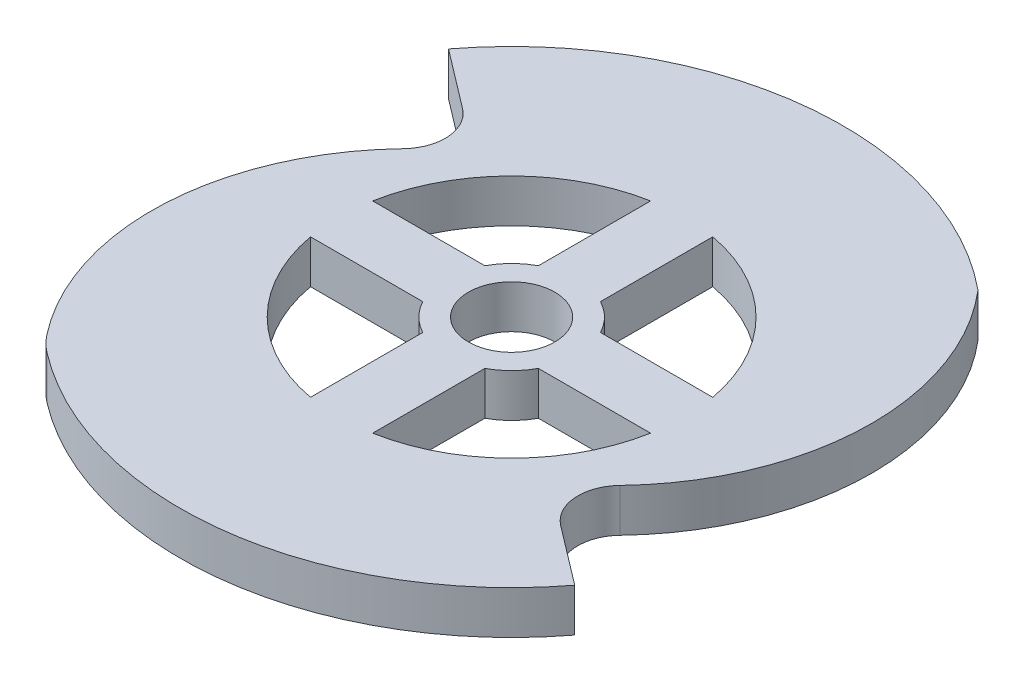
from build123d import *

# Parameters (mm, degrees)
SKETCH1_R           = 10
BOSS_EXTRUDE4_DEPTH = 10


with BuildPart() as part:
    # Sketch1 → Boss-Extrude4 (new body)
    with BuildSketch(Plane(origin=(0, 0, 0), x_dir=(1, 0, 0), z_dir=(0, 1, 0))):
        with BuildLine():
            ThreePointArc((48.558112711, 59.369560199), (-8.988128364, 76.16986633), (-61.043340866, 46.43646761))
            Line((-61.043340866, 46.43646761), (-47.4390603, 36.087513492))
            ThreePointArc((-47.4390603, 36.087513492), (-43.523761966, 28.906139952), (-46.278379725, 21.204596733))
            ThreePointArc((-46.278379725, 21.204596733), (-62.912922905, -17.344588104), (-50.204962373, -57.360277746))
            ThreePointArc((-50.204962373, -57.360277746), (-48.526113995, -59.243612618), (-46.623515218, -60.900597837))
            ThreePointArc((-46.623515218, -60.900597837), (10.212032546, -76.015454872), (61.043340866, -46.43646761))
            Line((61.043340866, -46.43646761), (47.4390603, -36.087513492))
            ThreePointArc((47.4390603, -36.087513492), (43.523761966, -28.906139952), (46.278379725, -21.204596733))
            ThreePointArc((46.278379725, -21.204596733), (62.96371797, 18.64264437), (48.558112711, 59.369560199))
        make_face()
        with BuildLine():
            ThreePointArc((-13.381070261, -7.191096034), (-10.741622398, -10.741622398), (-7.191096034, -13.381070261))
            Line((-7.191096034, -13.381070261), (-7.191096034, -39.348292693))
            ThreePointArc((-7.191096034, -39.348292693), (-28.284271247, -28.284271247), (-39.348292693, -7.191096034))
            Line((-39.348292693, -7.191096034), (-13.381070261, -7.191096034))
        make_face(mode=Mode.SUBTRACT)
        with BuildLine():
            Line((7.191096034, -39.348292693), (7.191096034, -13.381070261))
            ThreePointArc((7.191096034, -13.381070261), (10.741622398, -10.741622398), (13.381070261, -7.191096034))
            Line((13.381070261, -7.191096034), (39.348292693, -7.191096034))
            ThreePointArc((39.348292693, -7.191096034), (28.284271247, -28.284271247), (7.191096034, -39.348292693))
        make_face(mode=Mode.SUBTRACT)
        Circle(SKETCH1_R, mode=Mode.SUBTRACT)
        with BuildLine():
            ThreePointArc((-39.348292693, 7.191096034), (-28.284271247, 28.284271247), (-7.191096034, 39.348292693))
            Line((-7.191096034, 39.348292693), (-7.191096034, 13.381070261))
            ThreePointArc((-7.191096034, 13.381070261), (-10.741622398, 10.741622398), (-13.381070261, 7.191096034))
            Line((-13.381070261, 7.191096034), (-39.348292693, 7.191096034))
        make_face(mode=Mode.SUBTRACT)
        with BuildLine():
            Line((7.191096034, 13.381070261), (7.191096034, 39.348292693))
            ThreePointArc((7.191096034, 39.348292693), (28.284271247, 28.284271247), (39.348292693, 7.191096034))
            Line((39.348292693, 7.191096034), (13.381070261, 7.191096034))
            ThreePointArc((13.381070261, 7.191096034), (10.741622398, 10.741622398), (7.191096034, 13.381070261))
        make_face(mode=Mode.SUBTRACT)
    extrude(amount=BOSS_EXTRUDE4_DEPTH)


solid = part.part
